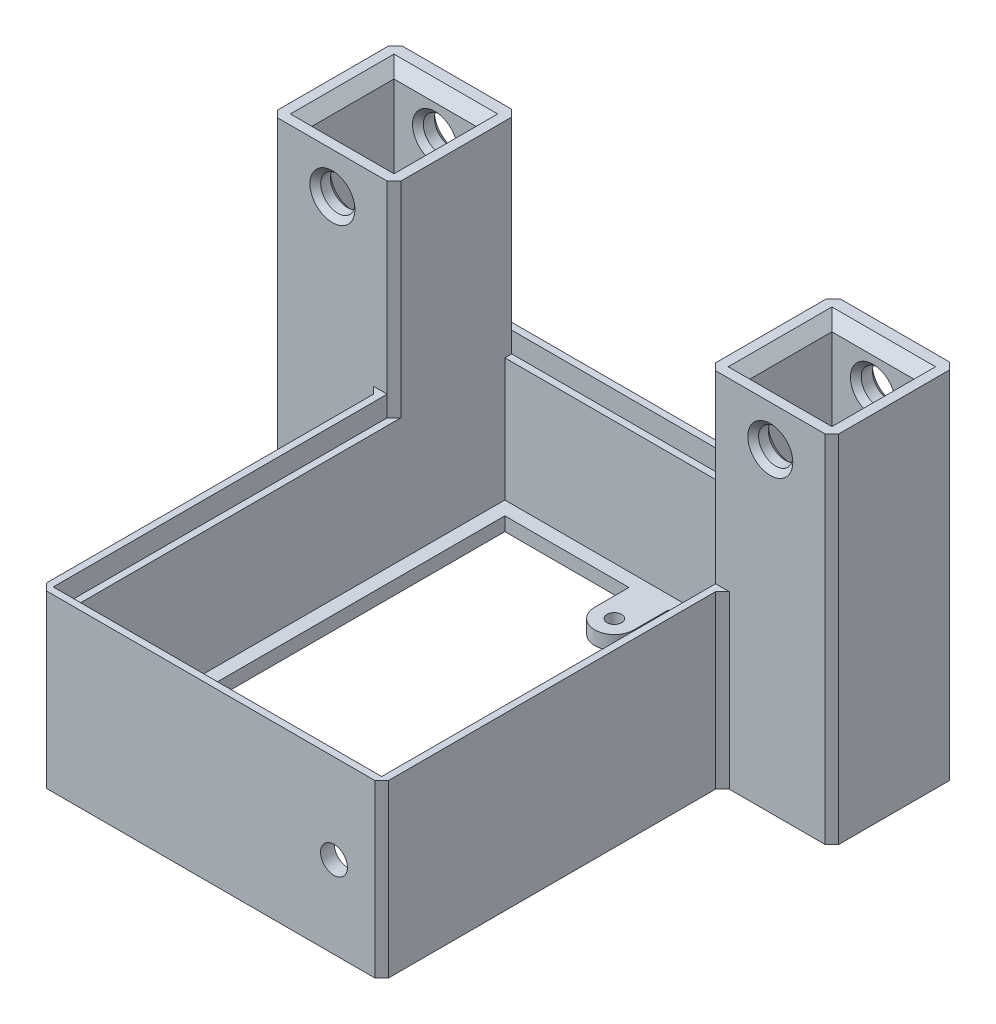
from build123d import *

# Parameters (mm, degrees)
SKETCH3_W                  = 63.5
SKETCH3_H                  = 86.36
BOSS_EXTRUDE2_DEPTH        = 31.75
SKETCH4_W                  = 58.42
SKETCH4_H                  = 81.28
CUT_EXTRUDE2_DEPTH         = 27.94
POWER_JACK_HOLE_REACH      = 113.796
SKETCH5_R                  = 5.715
MOTOR_MOUNTING_SHAPE_DEPTH = 63.5
MOTOR_MOUNTING_HOLES_REACH = 129.254
SKETCH8_R                  = 1.6
SKETCH13_W                 = 60.96
SKETCH13_H                 = 83.82
CUT_EXTRUDE7_DEPTH         = 3.81
SKETCH9_W                  = 15.24
SKETCH9_H                  = 15.24
BOSS_EXTRUDE3_DEPTH        = 66
CHAMFER1_SIZE              = 2
CUT_EXTRUDE5_DEPTH         = 126.858217451
SKETCH12_R                 = 3.175
LEG_HOLES_DEPTH            = 111.448682274
CHAMFER2_SIZE              = 1
BOSS_EXTRUDE5_START        = -5.08
SKETCH14_W                 = 58.42
SKETCH14_H                 = 81.28
SKETCH14_W_2               = 53.34
SKETCH14_H_2               = 76.2
BOSS_EXTRUDE5_DEPTH        = 2.54
CUT_EXTRUDE8_REACH         = 127.128
SKETCH15_R                 = 2.5
CHAMFER3_SIZE              = 1.27
SKETCH16_R                 = 1.35
BOSS_EXTRUDE6_DEPTH        = 2.54


with BuildPart() as part:
    # Sketch3 → Boss-Extrude2 (new body)
    with BuildSketch(Plane(origin=(0, 0, 0), x_dir=(-1, 0, 0), z_dir=(0, 1, 0))):
        with Locations((31.75, 43.18)):
            Rectangle(SKETCH3_W, SKETCH3_H)
    extrude(amount=-BOSS_EXTRUDE2_DEPTH)

    # Sketch4 → Cut-Extrude2 (cut)
    with BuildSketch(Plane.XZ.offset(31.75)):
        with Locations((-31.75, 43.18)):
            Rectangle(SKETCH4_W, SKETCH4_H)
    extrude(amount=-CUT_EXTRUDE2_DEPTH, mode=Mode.SUBTRACT)

    # Sketch5 → Power Jack Hole (cut, up to next)
    with BuildSketch(Plane(origin=(-63.5, 0, 0), x_dir=(0, 0, -1), z_dir=(1, 0, 0)), mode=Mode.PRIVATE) as power_jack_hole_sk1:
        with Locations(Location((-76.327, -19.177, 0), (0, 0, 180))):
            Circle(SKETCH5_R)
    power_jack_hole_tool1 = extrude(power_jack_hole_sk1.sketch, amount=POWER_JACK_HOLE_REACH, mode=Mode.PRIVATE) & part.part
    add(power_jack_hole_tool1.solids().sort_by_distance((-63.5, -19.177, 76.327))[0], mode=Mode.SUBTRACT)

    # Sketch6 → Motor Mounting Shape (add)
    with BuildSketch(Plane.ZY.offset(63.5)):
        Polygon((46.54, 0), (46.54, 36.83), (0, 36.83), (0, 34.29), (44, 34.29), (44, 0), align=None)
    extrude(amount=-MOTOR_MOUNTING_SHAPE_DEPTH)

    # Sketch8 → Motor-Mounting-Holes (cut, up to next)
    with BuildSketch(Plane(origin=(0, 36.83, 0), x_dir=(1, 0, 0), z_dir=(0, 1, 0)), mode=Mode.PRIVATE) as motor_mounting_holes_sk1:
        with Locations(Location((-47.25, -7.77, 0), (0, 0, 270))):
            Circle(SKETCH8_R)
    motor_mounting_holes_tool1 = extrude(motor_mounting_holes_sk1.sketch, amount=-MOTOR_MOUNTING_HOLES_REACH, mode=Mode.PRIVATE) & part.part
    # Sketch8 → Motor-Mounting-Holes (cut, up to next)
    with BuildSketch(Plane(origin=(0, 36.83, 0), x_dir=(1, 0, 0), z_dir=(0, 1, 0)), mode=Mode.PRIVATE) as motor_mounting_holes_sk2:
        with Locations(Location((-16.25, -7.77, 0), (0, 0, 270))):
            Circle(SKETCH8_R)
    motor_mounting_holes_tool2 = extrude(motor_mounting_holes_sk2.sketch, amount=-MOTOR_MOUNTING_HOLES_REACH, mode=Mode.PRIVATE) & part.part
    # Sketch8 → Motor-Mounting-Holes (cut, up to next)
    with BuildSketch(Plane(origin=(0, 36.83, 0), x_dir=(1, 0, 0), z_dir=(0, 1, 0)), mode=Mode.PRIVATE) as motor_mounting_holes_sk3:
        with Locations(Location((-16.25, -38.77, 0), (0, 0, 270))):
            Circle(SKETCH8_R)
    motor_mounting_holes_tool3 = extrude(motor_mounting_holes_sk3.sketch, amount=-MOTOR_MOUNTING_HOLES_REACH, mode=Mode.PRIVATE) & part.part
    # Sketch8 → Motor-Mounting-Holes (cut, up to next)
    with BuildSketch(Plane(origin=(0, 36.83, 0), x_dir=(1, 0, 0), z_dir=(0, 1, 0)), mode=Mode.PRIVATE) as motor_mounting_holes_sk4:
        with Locations(Location((-47.25, -38.77, 0), (0, 0, 270))):
            Circle(SKETCH8_R)
    motor_mounting_holes_tool4 = extrude(motor_mounting_holes_sk4.sketch, amount=-MOTOR_MOUNTING_HOLES_REACH, mode=Mode.PRIVATE) & part.part
    # Sketch8 → Motor-Mounting-Holes (cut, up to next)
    with BuildSketch(Plane(origin=(0, 36.83, 0), x_dir=(1, 0, 0), z_dir=(0, 1, 0)), mode=Mode.PRIVATE) as motor_mounting_holes_sk5:
        with BuildLine():
            Line((-40.64, 0), (-22.86, 0))
            Line((-22.86, 0), (-22.86, -23.27))
            ThreePointArc((-22.86, -23.27), (-31.75, -32.16), (-40.64, -23.27))
            Line((-40.64, -23.27), (-40.64, 0))
        make_face()
    motor_mounting_holes_tool5 = extrude(motor_mounting_holes_sk5.sketch, amount=-MOTOR_MOUNTING_HOLES_REACH, mode=Mode.PRIVATE) & part.part
    add(motor_mounting_holes_tool1.solids().sort_by_distance((-47.25, 36.83, 7.77))[0], mode=Mode.SUBTRACT)
    add(motor_mounting_holes_tool2.solids().sort_by_distance((-16.25, 36.83, 7.77))[0], mode=Mode.SUBTRACT)
    add(motor_mounting_holes_tool3.solids().sort_by_distance((-16.25, 36.83, 38.77))[0], mode=Mode.SUBTRACT)
    add(motor_mounting_holes_tool4.solids().sort_by_distance((-47.25, 36.83, 38.77))[0], mode=Mode.SUBTRACT)
    add(motor_mounting_holes_tool5.solids().sort_by_distance((-31.75, 36.83, 15.191166))[0], mode=Mode.SUBTRACT)

    # Sketch13 → Cut-Extrude7 (cut)
    with BuildSketch(Plane(origin=(0, 0, 0), x_dir=(1, 0, 0), z_dir=(0, 1, 0))):
        with Locations((-31.75, -43.18)):
            Rectangle(SKETCH13_W, SKETCH13_H)
    extrude(amount=-CUT_EXTRUDE7_DEPTH, mode=Mode.SUBTRACT)

    # Sketch9 → Boss-Extrude3 (add)
    # profile 1 of 2: a face of its own
    with BuildSketch(Plane.XZ.offset(31.75)):
        Polygon((1.27, 23.114), (-2.54, 23.114), (-2.54, 0), (1.27, 0), (20.32, 0), (20.32, 23.114), align=None)
        with Locations((8.89, 11.684)):
            Rectangle(SKETCH9_W, SKETCH9_H, mode=Mode.SUBTRACT)
    # profile 2 of 2: a face of its own
    with BuildSketch(Plane.XZ.offset(31.75)):
        Polygon((-60.96, 0), (-64.77, 0), (-83.82, 0), (-83.82, 23.114), (-64.77, 23.114), (-60.96, 23.114), align=None)
        with Locations((-72.39, 11.684)):
            Rectangle(SKETCH9_W, SKETCH9_H, mode=Mode.SUBTRACT)
    extrude(amount=-BOSS_EXTRUDE3_DEPTH)

    # Chamfer1
    chamfer1_edges = [part.edges().sort_by_distance(p)[0] for p in [
        (1.27, 34.25, 11.684),
        (8.89, 34.25, 19.304),
        (16.51, 34.25, 11.684),
        (8.89, 34.25, 4.064),
        (-72.39, 34.25, 19.304),
        (-80.01, 34.25, 11.684),
        (-72.39, 34.25, 4.064),
        (-64.77, 34.25, 11.684),
    ]]
    chamfer(chamfer1_edges, length=CHAMFER1_SIZE)

    # Sketch11 → Cut-Extrude5 (cut, through all)
    with BuildSketch(Plane(origin=(0, 0, 0), x_dir=(0, 0, -1), z_dir=(1, 0, 0))):
        Polygon((-44, 0), (-44, 34.29), (0, 34.29), (0, 36.83), (-86.36, 36.83), (-86.36, 0), align=None)
    extrude(amount=-CUT_EXTRUDE5_DEPTH, mode=Mode.SUBTRACT)

    # Sketch12 → Leg Holes (cut, through all)
    with BuildSketch(Plane.XY.offset(23.114)):
        with Locations((8.89, 26.67)):
            Circle(SKETCH12_R)
        with Locations((-72.39, 26.67)):
            Circle(SKETCH12_R)
    extrude(amount=-LEG_HOLES_DEPTH, mode=Mode.SUBTRACT)

    # Chamfer2
    chamfer2_edges = [part.edges().sort_by_distance(p)[0] for p in [
        (5.715, 26.67, 4.064),
        (5.715, 26.67, 19.304),
        (5.715, 26.67, 0),
        (5.715, 26.67, 23.114),
        (-75.565, 26.67, 19.304),
        (-75.565, 26.67, 0),
        (-75.565, 26.67, 4.064),
        (-75.565, 26.67, 23.114),
    ]]
    chamfer(chamfer2_edges, length=CHAMFER2_SIZE)

    # Sketch14 → Boss-Extrude5 (add)
    with BuildSketch(Plane.XZ.offset(31.75).offset(BOSS_EXTRUDE5_START)):
        with Locations((-31.75, 43.18)):
            Rectangle(SKETCH14_W, SKETCH14_H)
        with Locations((-31.75, 43.18)):
            Rectangle(SKETCH14_W_2, SKETCH14_H_2, mode=Mode.SUBTRACT)
    extrude(amount=BOSS_EXTRUDE5_DEPTH)

    # Sketch15 → Cut-Extrude8 (cut, up to next)
    with BuildSketch(Plane.XY.offset(86.36), mode=Mode.PRIVATE) as cut_extrude8_sk1:
        with Locations((-8.85, -16.55)):
            Circle(SKETCH15_R)
    cut_extrude8_tool1 = extrude(cut_extrude8_sk1.sketch, amount=-CUT_EXTRUDE8_REACH, mode=Mode.PRIVATE) & part.part
    add(cut_extrude8_tool1.solids().sort_by_distance((-8.85, -16.55, 86.36))[0], mode=Mode.SUBTRACT)

    # Chamfer3
    chamfer3_edges = [part.edges().sort_by_distance(p)[0] for p in [
        (20.32, 1.25, 0),
        (-2.54, 17.125, 0),
        (0, -15.875, 23.114),
        (-2.54, 15.22, 23.114),
        (20.32, 1.25, 23.114),
        (-60.96, 17.125, 0),
        (-60.96, 15.22, 23.114),
        (-63.5, -15.875, 23.114),
        (-83.82, 1.25, 0),
        (-83.82, 1.25, 23.114),
        (0, -15.875, 86.36),
        (-63.5, -15.875, 86.36),
    ]]
    chamfer(chamfer3_edges, length=CHAMFER3_SIZE - 0.0001)  # a hair under: the kernel refuses the full size

    # Sketch16 → Boss-Extrude6 (add)
    # profile 1 of 2: a face of its own
    with BuildSketch(Plane.XZ.offset(29.21)):
        with BuildLine():
            Line((-35.386, 2.54), (-28.114, 2.54))
            Line((-28.114, 2.54), (-28.114, 11.43))
            ThreePointArc((-28.114, 11.43), (-31.75, 15.066), (-35.386, 11.43))
            Line((-35.386, 11.43), (-35.386, 2.54))
        make_face()
        with Locations(Location((-31.75, 11.43, 0), (0, 0, 270))):
            Circle(SKETCH16_R, mode=Mode.SUBTRACT)
    # profile 2 of 2: a face of its own
    with BuildSketch(Plane.XZ.offset(29.21)):
        with BuildLine():
            Line((-35.386, 74.93), (-35.386, 83.82))
            Line((-35.386, 83.82), (-28.114, 83.82))
            Line((-28.114, 83.82), (-28.114, 74.93))
            ThreePointArc((-28.114, 74.93), (-31.75, 71.294), (-35.386, 74.93))
        make_face()
        with Locations(Location((-31.75, 74.93, 0), (0, 0, 270))):
            Circle(SKETCH16_R, mode=Mode.SUBTRACT)
    extrude(amount=-BOSS_EXTRUDE6_DEPTH)


solid = part.part
